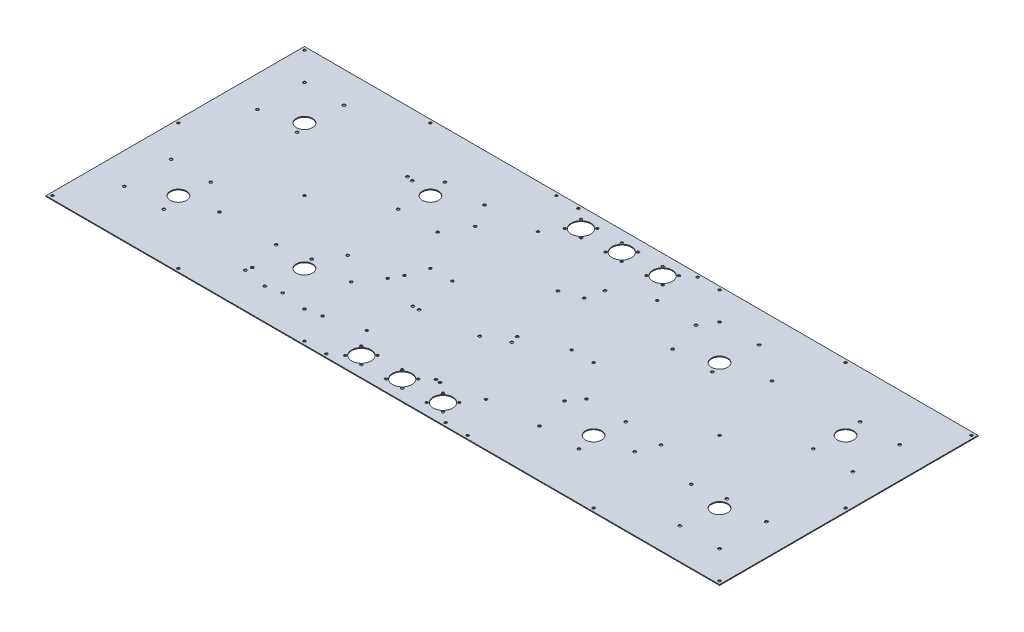
from build123d import *

# Parameters (mm, degrees)
MAIN_PLATE_W           = 834
MAIN_PLATE_H           = 320
BOSS_EXTRUDE1_DEPTH    = 1.016
MAIN_HOLES_R           = 1.6
CUT_EXTRUDE1_DEPTH     = 447.64307031
SMA_R                  = 10
CUT_EXTRUDE2_DEPTH     = 447.64307031
ADS9_EVAL_2_R          = 1.75
FULL_HOLES_DEPTH       = 448.008036295
FAN_R                  = 1.6
FAN_R_2                = 12
CUT_EXTRUDE4_DEPTH     = 448.375011908
CUT_EXTRUDE5_START     = -1.016
CUT_EXTRUDE5_OUTLINE_R = 1.75
CUT_EXTRUDE5_DEPTH     = 1.016


# Read off the part's stored shape, not the designer's step: Cut-Extrude5
with BuildPart() as part:
    # main_plate → Boss-Extrude1 (new body)
    with BuildSketch(Plane(origin=(0, 0, 0), x_dir=(1, 0, 0), z_dir=(0, 1, 0))):
        Rectangle(MAIN_PLATE_W, MAIN_PLATE_H)
    extrude(amount=BOSS_EXTRUDE1_DEPTH)

    # main_holes → Cut-Extrude1 (cut, through all)
    with BuildSketch(Plane(origin=(0, 1.016, 0), x_dir=(1, 0, 0), z_dir=(0, 1, 0))):
        with Locations(Location((-413, 156, 0), (0, 0, 270))):
            Circle(MAIN_HOLES_R)
        with Locations(Location((-257, 156, 0), (0, 0, 270))):
            Circle(MAIN_HOLES_R)
        with Locations(Location((-101, 156, 0), (0, 0, 270))):
            Circle(MAIN_HOLES_R)
        with Locations(Location((-257, 0, 0), (0, 0, 270))):
            Circle(MAIN_HOLES_R)
        with Locations(Location((-101, 0, 0), (0, 0, 270))):
            Circle(MAIN_HOLES_R)
        with Locations(Location((-257, -156, 0), (0, 0, 270))):
            Circle(MAIN_HOLES_R)
        with Locations(Location((-101, -156, 0), (0, 0, 270))):
            Circle(MAIN_HOLES_R)
        with Locations(Location((-413, 0, 0), (0, 0, 270))):
            Circle(MAIN_HOLES_R)
        with Locations(Location((-413, -156, 0), (0, 0, 270))):
            Circle(MAIN_HOLES_R)
        with Locations(Location((413, -156, 0), (0, 0, 90))):
            Circle(MAIN_HOLES_R)
        with Locations(Location((413, 0, 0), (0, 0, 90))):
            Circle(MAIN_HOLES_R)
        with Locations(Location((101, -156, 0), (0, 0, 90))):
            Circle(MAIN_HOLES_R)
        with Locations(Location((257, -156, 0), (0, 0, 90))):
            Circle(MAIN_HOLES_R)
        with Locations(Location((101, 0, 0), (0, 0, 90))):
            Circle(MAIN_HOLES_R)
        with Locations(Location((257, 0, 0), (0, 0, 90))):
            Circle(MAIN_HOLES_R)
        with Locations(Location((101, 156, 0), (0, 0, 90))):
            Circle(MAIN_HOLES_R)
        with Locations(Location((257, 156, 0), (0, 0, 90))):
            Circle(MAIN_HOLES_R)
        with Locations(Location((413, 156, 0), (0, 0, 90))):
            Circle(MAIN_HOLES_R)
        with Locations(Location((73.81875, -156, 0), (0, 0, 270))):
            Circle(MAIN_HOLES_R)
        with Locations(Location((-73.81875, -156, 0), (0, 0, 90))):
            Circle(MAIN_HOLES_R)
        with Locations(Location((-73.81875, 156, 0), (0, 0, 270))):
            Circle(MAIN_HOLES_R)
        with Locations(Location((73.81875, 156, 0), (0, 0, 90))):
            Circle(MAIN_HOLES_R)
        with Locations(Location((-73.81875, 106, 0), (0, 0, 270))):
            Circle(MAIN_HOLES_R)
        with Locations(Location((73.81875, 106, 0), (0, 0, 90))):
            Circle(MAIN_HOLES_R)
        with Locations(Location((-73.81875, 0, 0), (0, 0, 270))):
            Circle(MAIN_HOLES_R)
        with Locations(Location((73.81875, 0, 0), (0, 0, 90))):
            Circle(MAIN_HOLES_R)
        with Locations(Location((-73.81875, -106, 0), (0, 0, 90))):
            Circle(MAIN_HOLES_R)
        with Locations(Location((73.81875, -106, 0), (0, 0, 270))):
            Circle(MAIN_HOLES_R)
    extrude(amount=-CUT_EXTRUDE1_DEPTH, mode=Mode.SUBTRACT)

    # sma → Cut-Extrude2 (cut, through all)
    with BuildSketch(Plane(origin=(0, 1.016, 0), x_dir=(1, 0, 0), z_dir=(0, 1, 0))):
        with Locations(Location((-335, 78, 0), (0, 0, 270))):
            Circle(SMA_R)
        with Locations(Location((-179, 78, 0), (0, 0, 270))):
            Circle(SMA_R)
        with Locations(Location((-179, -78, 0), (0, 0, 270))):
            Circle(SMA_R)
        with Locations(Location((-335, -78, 0), (0, 0, 270))):
            Circle(SMA_R)
        with Locations(Location((335, 78, 0), (0, 0, 90))):
            Circle(SMA_R)
        with Locations(Location((179, 78, 0), (0, 0, 90))):
            Circle(SMA_R)
        with Locations(Location((335, -78, 0), (0, 0, 90))):
            Circle(SMA_R)
        with Locations(Location((179, -78, 0), (0, 0, 90))):
            Circle(SMA_R)
    extrude(amount=-CUT_EXTRUDE2_DEPTH, mode=Mode.SUBTRACT)

    # ads9_eval_2 → full_holes (cut, through all)
    with BuildSketch(Plane(origin=(0, 1.016, 1.016), x_dir=(1, 0, 0), z_dir=(0, 1, 0))):
        with Locations(Location((-213.565632704, 85.178029062, 0), (0, 0, 270))):
            Circle(ADS9_EVAL_2_R)
        with Locations(Location((-206.325632704, 83.858029062, 0), (0, 0, 270))):
            Circle(ADS9_EVAL_2_R)
        with Locations(Location((-212.305632704, -108.301970938, 0), (0, 0, 270))):
            Circle(ADS9_EVAL_2_R)
        with Locations(Location((-213.575632704, -115.481970938, 0), (0, 0, 270))):
            Circle(ADS9_EVAL_2_R)
        with Locations(Location((-71.335632704, -50.391970938, 0), (0, 0, 270))):
            Circle(ADS9_EVAL_2_R)
        with Locations(Location((-63.715632704, -50.391970938, 0), (0, 0, 270))):
            Circle(ADS9_EVAL_2_R)
        with Locations(Location((2.144367296, -41.141970938, 0), (0, 0, 270))):
            Circle(ADS9_EVAL_2_R)
        with Locations(Location((-109.615632704, -22.761970938, 0), (0, 0, 270))):
            Circle(ADS9_EVAL_2_R)
        with Locations(Location((28.534367296, -27.851970938, 0), (0, 0, 270))):
            Circle(ADS9_EVAL_2_R)
        with Locations(Location((25.824367296, -18.381970938, 0), (0, 0, 270))):
            Circle(ADS9_EVAL_2_R)
        with Locations(Location((21.624367296, -114.521970938, 0), (0, 0, 270))):
            Circle(ADS9_EVAL_2_R)
        with Locations(Location((27.266804194, -115.481970938, 0), (0, 0, 270))):
            Circle(ADS9_EVAL_2_R)
        with Locations(Location((2.154367296, 55.888029062, 0), (0, 0, 270))):
            Circle(ADS9_EVAL_2_R)
        with Locations(Location((25.984367296, 64.418029062, 0), (0, 0, 270))):
            Circle(ADS9_EVAL_2_R)
        with Locations(Location((30.904367296, 85.178029062, 0), (0, 0, 270))):
            Circle(ADS9_EVAL_2_R)
        with Locations(Location((-118.315632704, 73.788029062, 0), (0, 0, 270))):
            Circle(ADS9_EVAL_2_R)
        with Locations(Location((124.354014482, 104.524146981, 0), (0, 0, 270))):
            Circle(ADS9_EVAL_2_R)
        with Locations(Location((231.034014482, 91.766913394, 0), (0, 0, 270))):
            Circle(ADS9_EVAL_2_R)
        with Locations(Location((230.960430802, -45.393066868, 0), (0, 0, 90))):
            Circle(ADS9_EVAL_2_R)
        with Locations(Location((124.266804194, -58.035829625, 0), (0, 0, 90))):
            Circle(ADS9_EVAL_2_R)
        with Locations(Location((-166.204632704, -116.688470938, 0), (0, 0, 270))):
            Circle(ADS9_EVAL_2_R)
        with Locations(Location((-116.674632704, -116.688470938, 0), (0, 0, 270))):
            Circle(ADS9_EVAL_2_R)
        with Locations(Location((-166.204632704, -36.170470938, 0), (0, 0, 270))):
            Circle(ADS9_EVAL_2_R)
        with Locations(Location((-116.674632704, -36.170470938, 0), (0, 0, 270))):
            Circle(ADS9_EVAL_2_R)
    extrude(amount=-FULL_HOLES_DEPTH, mode=Mode.SUBTRACT)

    # fan → Cut-Extrude4 (cut, through all)
    with BuildSketch(Plane(origin=(0, 1.016, -2.032), x_dir=(1, 0, 0), z_dir=(0, -1, 0))):
        with Locations(Location((-10, -123.968, 0), (0, 0, 270))):
            Circle(FAN_R)
        with Locations(Location((10, -123.968, 0), (0, 0, 270))):
            Circle(FAN_R)
        with Locations(Location((10, -143.968, 0), (0, 0, 270))):
            Circle(FAN_R)
        with Locations(Location((-10, -143.968, 0), (0, 0, 270))):
            Circle(FAN_R)
        with Locations(Location((0, -133.968, 0), (0, 0, 270))):
            Circle(FAN_R_2)
        with Locations(Location((-60.5, -123.968, 0), (0, 0, 270))):
            Circle(FAN_R)
        with Locations(Location((-40.5, -123.968, 0), (0, 0, 270))):
            Circle(FAN_R)
        with Locations(Location((-40.5, -143.968, 0), (0, 0, 270))):
            Circle(FAN_R)
        with Locations(Location((-60.5, -143.968, 0), (0, 0, 270))):
            Circle(FAN_R)
        with Locations(Location((-50.5, -133.968, 0), (0, 0, 270))):
            Circle(FAN_R_2)
        with Locations(Location((40.5, -123.968, 0), (0, 0, 270))):
            Circle(FAN_R)
        with Locations(Location((60.5, -123.968, 0), (0, 0, 270))):
            Circle(FAN_R)
        with Locations(Location((60.5, -143.968, 0), (0, 0, 270))):
            Circle(FAN_R)
        with Locations(Location((40.5, -143.968, 0), (0, 0, 270))):
            Circle(FAN_R)
        with Locations(Location((50.5, -133.968, 0), (0, 0, 270))):
            Circle(FAN_R_2)
        with Locations(Location((-10, 148.032, 0), (0, 0, 270))):
            Circle(FAN_R)
        with Locations(Location((10, 148.032, 0), (0, 0, 270))):
            Circle(FAN_R)
        with Locations(Location((10, 128.032, 0), (0, 0, 270))):
            Circle(FAN_R)
        with Locations(Location((-10, 128.032, 0), (0, 0, 270))):
            Circle(FAN_R)
        with Locations(Location((0, 138.032, 0), (0, 0, 270))):
            Circle(FAN_R_2)
        with Locations(Location((-60.5, 148.032, 0), (0, 0, 270))):
            Circle(FAN_R)
        with Locations(Location((-40.5, 148.032, 0), (0, 0, 270))):
            Circle(FAN_R)
        with Locations(Location((-40.5, 128.032, 0), (0, 0, 270))):
            Circle(FAN_R)
        with Locations(Location((-60.5, 128.032, 0), (0, 0, 270))):
            Circle(FAN_R)
        with Locations(Location((-50.5, 138.032, 0), (0, 0, 270))):
            Circle(FAN_R_2)
        with Locations(Location((40.5, 148.032, 0), (0, 0, 270))):
            Circle(FAN_R)
        with Locations(Location((60.5, 148.032, 0), (0, 0, 270))):
            Circle(FAN_R)
        with Locations(Location((60.5, 128.032, 0), (0, 0, 270))):
            Circle(FAN_R)
        with Locations(Location((40.5, 128.032, 0), (0, 0, 270))):
            Circle(FAN_R)
        with Locations(Location((50.5, 138.032, 0), (0, 0, 270))):
            Circle(FAN_R_2)
    extrude(amount=CUT_EXTRUDE4_DEPTH, mode=Mode.SUBTRACT)

    # Cut-Extrude5 outline → Cut-Extrude5 (cut)
    with BuildSketch(Plane(origin=(0, 1.016, 0), x_dir=(1, 0, 0), z_dir=(0, 1, 0)).offset(CUT_EXTRUDE5_START)):
        with Locations((-378.5, -43.5)):
            Circle(CUT_EXTRUDE5_OUTLINE_R)
        with Locations((184.5, -43.5)):
            Circle(CUT_EXTRUDE5_OUTLINE_R)
        with Locations((135.5, -101.5)):
            Circle(CUT_EXTRUDE5_OUTLINE_R)
        with Locations((184.5, -101.5)):
            Circle(CUT_EXTRUDE5_OUTLINE_R)
        with Locations((-184.5, 43.5)):
            Circle(CUT_EXTRUDE5_OUTLINE_R)
        with Locations((-135.5, -63.5)):
            Circle(CUT_EXTRUDE5_OUTLINE_R)
        with Locations((-184.5, -63.5)):
            Circle(CUT_EXTRUDE5_OUTLINE_R)
        with Locations((-135.5, -121.5)):
            Circle(CUT_EXTRUDE5_OUTLINE_R)
        with Locations((-292.024, -70)):
            Circle(CUT_EXTRUDE5_OUTLINE_R)
        with Locations((-135.5, 101.5)):
            Circle(CUT_EXTRUDE5_OUTLINE_R)
        with Locations((-184.5, 101.5)):
            Circle(CUT_EXTRUDE5_OUTLINE_R)
        with Locations((-135.5, 43.5)):
            Circle(CUT_EXTRUDE5_OUTLINE_R)
        with Locations((-378.5, 121.5)):
            Circle(CUT_EXTRUDE5_OUTLINE_R)
        with Locations((-329.5, -101.5)):
            Circle(CUT_EXTRUDE5_OUTLINE_R)
        with Locations((-378.5, -101.5)):
            Circle(CUT_EXTRUDE5_OUTLINE_R)
        with Locations((-329.5, -43.5)):
            Circle(CUT_EXTRUDE5_OUTLINE_R)
        with Locations((-184.5, -121.5)):
            Circle(CUT_EXTRUDE5_OUTLINE_R)
        with Locations((-329.5, 63.5)):
            Circle(CUT_EXTRUDE5_OUTLINE_R)
        with Locations((-378.5, 63.5)):
            Circle(CUT_EXTRUDE5_OUTLINE_R)
        with Locations((-329.5, 121.5)):
            Circle(CUT_EXTRUDE5_OUTLINE_R)
        with Locations((329.5, 43.5)):
            Circle(CUT_EXTRUDE5_OUTLINE_R)
        with Locations((184.5, 63.5)):
            Circle(CUT_EXTRUDE5_OUTLINE_R)
        with Locations((135.5, 63.5)):
            Circle(CUT_EXTRUDE5_OUTLINE_R)
        with Locations((184.5, 121.5)):
            Circle(CUT_EXTRUDE5_OUTLINE_R)
        with Locations((135.5, -43.5)):
            Circle(CUT_EXTRUDE5_OUTLINE_R)
        with Locations((378.5, 101.5)):
            Circle(CUT_EXTRUDE5_OUTLINE_R)
        with Locations((329.5, 101.5)):
            Circle(CUT_EXTRUDE5_OUTLINE_R)
        with Locations((378.5, 43.5)):
            Circle(CUT_EXTRUDE5_OUTLINE_R)
        with Locations((329.5, -63.5)):
            Circle(CUT_EXTRUDE5_OUTLINE_R)
        with Locations((378.5, -121.5)):
            Circle(CUT_EXTRUDE5_OUTLINE_R)
        with Locations((329.5, -121.5)):
            Circle(CUT_EXTRUDE5_OUTLINE_R)
        with Locations((-221.976, -70)):
            Circle(CUT_EXTRUDE5_OUTLINE_R)
        with Locations((135.5, 121.5)):
            Circle(CUT_EXTRUDE5_OUTLINE_R)
        with Locations((292.024, -70)):
            Circle(CUT_EXTRUDE5_OUTLINE_R)
        with Locations((221.976, -70)):
            Circle(CUT_EXTRUDE5_OUTLINE_R)
        with Locations((378.5, -63.5)):
            Circle(CUT_EXTRUDE5_OUTLINE_R)
    extrude(amount=CUT_EXTRUDE5_DEPTH, mode=Mode.SUBTRACT)


solid = part.part
